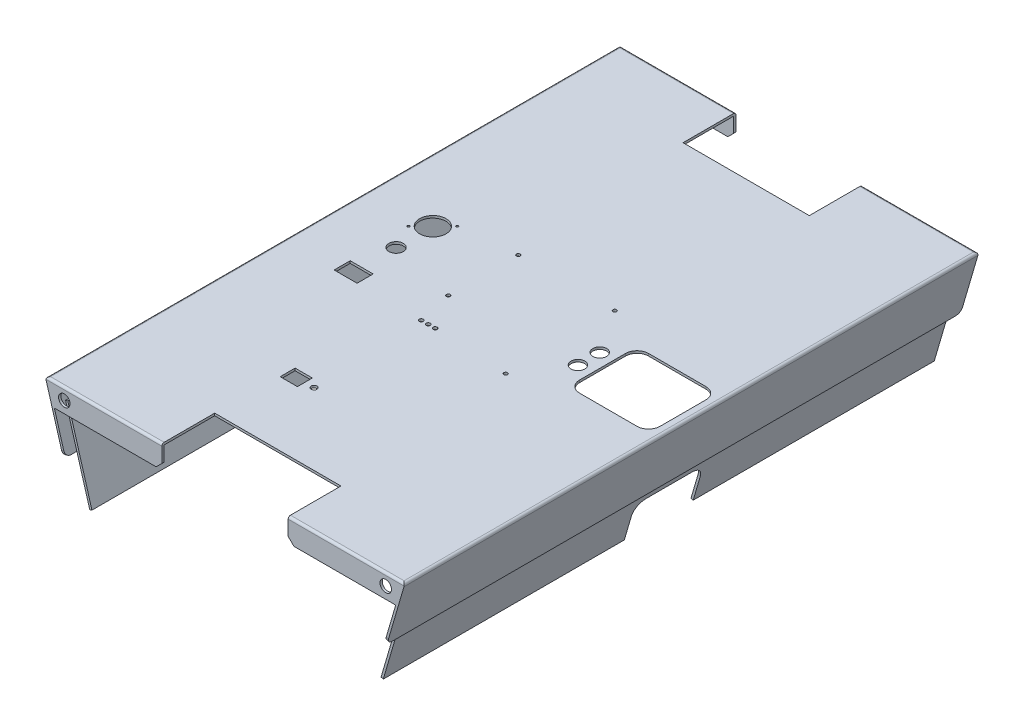
from build123d import *

# Parameters (mm, degrees)
EXTRUSION1_DEPTH             = 500
CONG_1_R                     = 5
EXTRUSION2_DEPTH             = 2
ENL_V_MAT_EXTRU_1_DEPTH      = 2
EXTRUSION3_DEPTH             = 2
ESQUISSE6_W                  = 110
ESQUISSE6_H                  = 46
ENL_V_MAT_EXTRU_7_DEPTH      = 532.648435432
CHANFREIN1_SIZE              = 5
CHANFREIN1_OF_SYM_TRIE4_SIZE = 5
CONG_4_START                 = -157
CONG_4_DEPTH                 = 314
ESQUISSE7_R                  = 5
ENL_V_MAT_EXTRU_8_DEPTH      = 532.648435555
ESQUISSE8_R                  = 6.25
ESQUISSE8_R_2                = 11.5
ESQUISSE8_R_3                = 1
ESQUISSE8_R_4                = 6
ESQUISSE8_R_5                = 2.5
ESQUISSE8_W                  = 20
ESQUISSE8_H                  = 14
ESQUISSE8_W_2                = 15
ESQUISSE8_H_2                = 13
ENL_V_MAT_EXTRU_9_DEPTH      = 2
ESQUISSE9_R                  = 1.6
ESQUISSE9_R_2                = 1.75
ENL_V_MAT_EXTRU_10_DEPTH     = 2


with BuildPart() as part:
    # Esquisse1 → Extrusion1 (new body)
    with BuildSketch(Plane.XY):
        with BuildLine():
            Line((-153.951793051, 0), (153.951793051, 0))
            ThreePointArc((153.951793051, 0), (155.552163839, -0.800494544), (155.871446543, -2.561186662))
            Line((155.871446543, -2.561186662), (141, -53.432004207))
            Line((141, -53.432004207), (139.080346508, -52.870817545))
            Line((139.080346508, -52.870817545), (153.951793051, -2))
            Line((153.951793051, -2), (-153.951793051, -2))
            Line((-153.951793051, -2), (-139.080346508, -52.870817545))
            Line((-139.080346508, -52.870817545), (-141, -53.432004207))
            Line((-141, -53.432004207), (-155.871446543, -2.561186662))
            ThreePointArc((-155.871446543, -2.561186662), (-155.552163839, -0.800494544), (-153.951793051, 0))
        make_face()
    extrude(amount=EXTRUSION1_DEPTH)

    # Congé1
    cong_1_edges = [part.edges().sort_by_distance(p)[0] for p in [
        (-140.040173254, -53.151410876, 0),
        (-140.040173254, -53.151410876, 500),
        (140.040173254, -53.151410876, 500),
        (140.040173254, -53.151410876, 0),
    ]]
    fillet(cong_1_edges, radius=CONG_1_R)

    # Esquisse2 → Extrusion2 (add)
    with BuildSketch(Plane(origin=(-142.369407398, -41.619913609, 0), x_dir=(0, 0, -1), z_dir=(0.9598267461373389, 0.2805933309959605, 0))):
        with BuildLine():
            Line((-490, 23.278192933), (-10, 23.278192933))
            Line((-10, 23.278192933), (-10, -51.721807067))
            Line((-10, -51.721807067), (-220, -51.721807067))
            Line((-220, -51.721807067), (-220, -29.721807067))
            ThreePointArc((-220, -29.721807067), (-222.928932188, -22.650739256), (-230, -19.721807067))
            Line((-230, -19.721807067), (-270, -19.721807067))
            ThreePointArc((-270, -19.721807067), (-277.071067812, -22.650739256), (-280, -29.721807067))
            Line((-280, -29.721807067), (-280, -51.721807067))
            Line((-280, -51.721807067), (-490, -51.721807067))
            Line((-490, -51.721807067), (-490, 23.278192933))
        make_face()
    extrusion2 = extrude(amount=EXTRUSION2_DEPTH)

    # Symétrie1: Extrusion2 across plane
    add(extrusion2.mirror(Plane(origin=(0, 0, 0), x_dir=(0, 0, 1), z_dir=(1, 0, 0))))

    # Esquisse3 → Enlèv. mat.-Extru.1 (cut)
    with BuildSketch(Plane(origin=(0, 0, 0), x_dir=(-1, 0, 0), z_dir=(0, 1, 0))):
        with BuildLine():
            Line((-138.951793051, 220), (-88.951793051, 220))
            ThreePointArc((-88.951793051, 220), (-81.880725239, 222.928932188), (-78.951793051, 230))
            Line((-78.951793051, 230), (-78.951793051, 270))
            ThreePointArc((-78.951793051, 270), (-81.880725239, 277.071067812), (-88.951793051, 280))
            Line((-88.951793051, 280), (-138.951793051, 280))
            ThreePointArc((-138.951793051, 280), (-146.022860862, 277.071067812), (-148.951793051, 270))
            Line((-148.951793051, 270), (-148.951793051, 230))
            ThreePointArc((-148.951793051, 230), (-146.022860862, 222.928932188), (-138.951793051, 220))
        make_face()
    extrude(amount=-ENL_V_MAT_EXTRU_1_DEPTH, mode=Mode.SUBTRACT)

    # Esquisse4 → Extrusion3 (add)
    with BuildSketch(Plane(origin=(0, 0, 0), x_dir=(-1, 0, 0), z_dir=(0, 0, -1))):
        Polygon((153.951793051, -2), (-153.951793051, -2), (-148.689718433, -20), (148.689718433, -20), align=None)
    extrusion3 = extrude(amount=-EXTRUSION3_DEPTH)

    # Esquisse6 → Enlèv. mat.-Extru.7 (cut, through all)
    with BuildSketch(Plane(origin=(0, 0, 0), x_dir=(-1, 0, 0), z_dir=(0, 1, 0))):
        with Locations((0, 23)):
            Rectangle(ESQUISSE6_W, ESQUISSE6_H)
    enl_v_mat_extru_7 = extrude(amount=-ENL_V_MAT_EXTRU_7_DEPTH, mode=Mode.SUBTRACT)

    # Chanfrein1
    chanfrein1_edges = [part.edges().sort_by_distance(p)[0] for p in [
        (55, -20, 1),
        (-55, -20, 1),
    ]]
    chamfer(chanfrein1_edges, length=CHANFREIN1_SIZE)

    # Symétrie4: Extrusion3, Enlèv. mat.-Extru.7 across plane
    add(extrusion3.mirror(Plane.XY.offset(250)))
    add(enl_v_mat_extru_7.mirror(Plane.XY.offset(250)), mode=Mode.SUBTRACT)

    # Chanfrein1 of Symétrie4
    chanfrein1_of_sym_trie4_edges = [part.edges().sort_by_distance(p)[0] for p in [
        (55, -20, 499),
        (-55, -20, 499),
    ]]
    chamfer(chanfrein1_of_sym_trie4_edges, length=CHANFREIN1_OF_SYM_TRIE4_SIZE)

    # Congé4: read off the stored shape, not the designer's step
    # Congé4 outline → Congé4 (cut)
    with BuildSketch(Plane.YZ.offset(CONG_4_START)):
        with BuildLine():
            Line((0, 500), (-2, 500))
            ThreePointArc((-2, 500), (-0.585786438, 499.414213562), (0, 498))
            Line((0, 498), (0, 500))
        make_face()
        with BuildLine():
            Line((0, 0), (0, 2))
            ThreePointArc((0, 2), (-0.585786438, 0.585786438), (-2, 0))
            Line((-2, 0), (0, 0))
        make_face()
    extrude(amount=CONG_4_DEPTH, mode=Mode.SUBTRACT)

    # Esquisse7 → Enlèv. mat.-Extru.8 (cut, through all)
    with BuildSketch(Plane.XY.offset(500)):
        with Locations((-140, -10)):
            Circle(ESQUISSE7_R)
        with Locations((140, -10)):
            Circle(ESQUISSE7_R)
    extrude(amount=-ENL_V_MAT_EXTRU_8_DEPTH, mode=Mode.SUBTRACT)

    # Esquisse8 → Enlèv. mat.-Extru.9 (cut)
    with BuildSketch(Plane(origin=(0, 0, 0), x_dir=(-1, 0, 0), z_dir=(0, 1, 0))):
        with Locations(Location((100.951793051, 250, 0), (0, 0, 90))):
            Circle(ESQUISSE8_R)
        with Locations(Location((100.951793051, 218, 0), (0, 0, 90))):
            Circle(ESQUISSE8_R_2)
        with Locations(Location((111.558394768, 228.606601718, 0), (0, 0, 90))):
            Circle(ESQUISSE8_R_3)
        with Locations(Location((90.345191333, 207.393398282, 0), (0, 0, 90))):
            Circle(ESQUISSE8_R_3)
        with Locations(Location((-66.951793051, 240.5, 0), (0, 0, 90))):
            Circle(ESQUISSE8_R_4)
        with Locations(Location((-66.951793051, 259.5, 0), (0, 0, 90))):
            Circle(ESQUISSE8_R_4)
        with Locations(Location((30.951793051, 391.5, 0), (0, 0, 90))):
            Circle(ESQUISSE8_R_5)
        with Locations((100.951793051, 287)):
            Rectangle(ESQUISSE8_W, ESQUISSE8_H)
        with Locations((46.451793051, 391.5)):
            Rectangle(ESQUISSE8_W_2, ESQUISSE8_H_2)
    extrude(amount=-ENL_V_MAT_EXTRU_9_DEPTH, mode=Mode.SUBTRACT)

    # Esquisse9 → Enlèv. mat.-Extru.10 (cut)
    with BuildSketch(Plane(origin=(0, 0, 0), x_dir=(-1, 0, 0), z_dir=(0, 1, 0))):
        with Locations(Location((-42, 202.5, 0), (0, 0, 90))):
            Circle(ESQUISSE9_R)
        with Locations(Location((-42, 297.5, 0), (0, 0, 90))):
            Circle(ESQUISSE9_R)
        with Locations(Location((42, 202.5, 0), (0, 0, 90))):
            Circle(ESQUISSE9_R)
        with Locations(Location((42, 263.5, 0), (0, 0, 90))):
            Circle(ESQUISSE9_R)
        with Locations(Location((23, 294, 0), (0, 0, 90))):
            Circle(ESQUISSE9_R_2)
        with Locations(Location((29, 294, 0), (0, 0, 90))):
            Circle(ESQUISSE9_R_2)
        with Locations(Location((35, 294, 0), (0, 0, 90))):
            Circle(ESQUISSE9_R_2)
    extrude(amount=-ENL_V_MAT_EXTRU_10_DEPTH, mode=Mode.SUBTRACT)


solid = part.part
